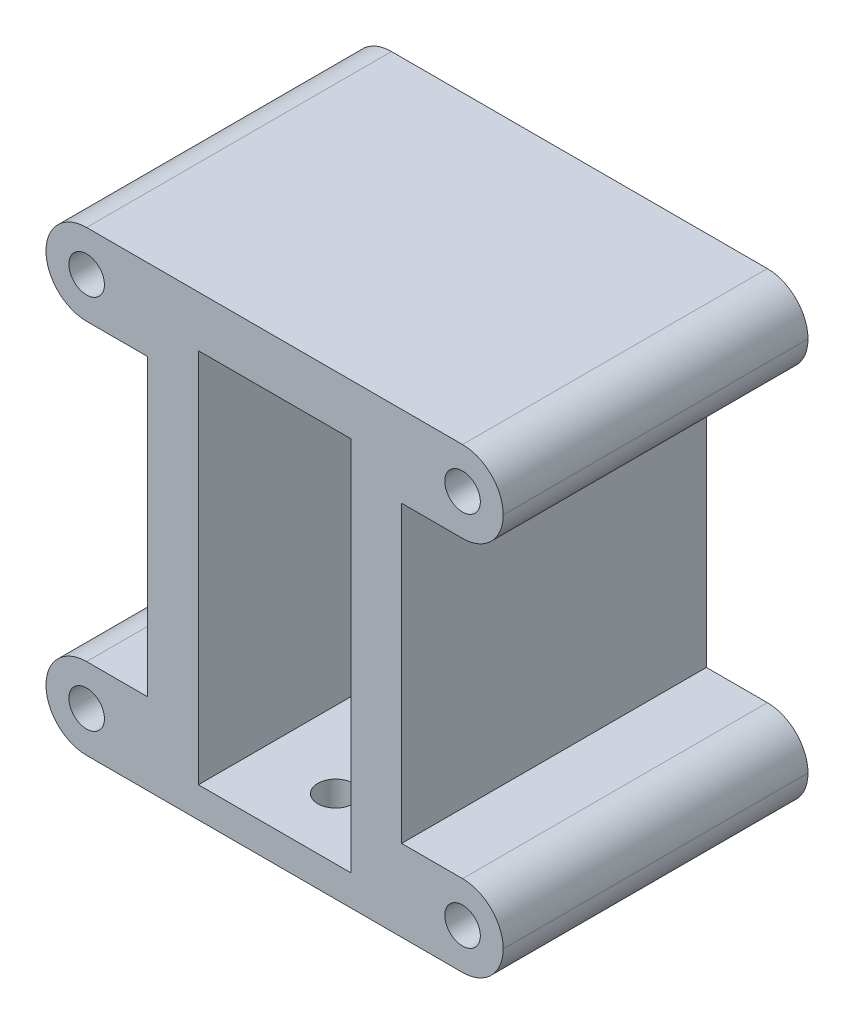
from build123d import *

# Parameters (mm, degrees)
CROQUIS3_W               = 25
CROQUIS3_H               = 45
CROQUIS3_W_2             = 15
CROQUIS3_H_2             = 37
SALIENTE_EXTRUIR1_DEPTH  = 30
CROQUIS4_W               = 30
CROQUIS4_H               = 8
SALIENTE_EXTRUIR2_DEPTH  = 10
CROQUIS5_R               = 1.75
CORTAR_EXTRUIR1_DEPTH    = 49.567948266
REDONDEO1_R              = 4
REDONDEO1_OF_SIMETR_A1_R = 4
CROQUIS7_R               = 1.75
CORTAR_EXTRUIR2_DEPTH    = 59.25672149


with BuildPart() as part:
    # Croquis3 → Saliente-Extruir1 (new body)
    with BuildSketch(Plane.XY):
        with Locations((-4.515654699, -4.5)):
            Rectangle(CROQUIS3_W, CROQUIS3_H)
        with Locations((-4.515654699, -5.5)):
            Rectangle(CROQUIS3_W_2, CROQUIS3_H_2, mode=Mode.SUBTRACT)
    extrude(amount=SALIENTE_EXTRUIR1_DEPTH)

    # Croquis4 → Saliente-Extruir2 (add)
    with BuildSketch(Plane.ZY.offset(17.015654699)):
        with Locations((15, 14)):
            Rectangle(CROQUIS4_W, CROQUIS4_H)
        with Locations((15, -23)):
            Rectangle(CROQUIS4_W, CROQUIS4_H)
    saliente_extruir2 = extrude(amount=SALIENTE_EXTRUIR2_DEPTH)

    # Croquis5 → Cortar-Extruir1 (cut, symmetric)
    with BuildSketch(Plane.XY.offset(30)):
        with Locations((-23.015654699, 14)):
            Circle(CROQUIS5_R)
        with Locations((-23.015654699, -23)):
            Circle(CROQUIS5_R)
    cortar_extruir1 = extrude(amount=CORTAR_EXTRUIR1_DEPTH, both=True, mode=Mode.SUBTRACT)

    # Redondeo1
    redondeo1_edges = [part.edges().sort_by_distance(p)[0] for p in [
        (-27.015654699, -27, 15),
        (-27.015654699, -19, 15),
        (-27.015654699, 10, 15),
        (-27.015654699, 18, 15),
    ]]
    fillet(redondeo1_edges, radius=REDONDEO1_R - 0.0001)  # a hair under: the kernel refuses the full size

    # Simetría1: Saliente-Extruir2, Cortar-Extruir1 across plane
    add(saliente_extruir2.mirror(Plane.ZY.offset(4.515654699)))
    add(cortar_extruir1.mirror(Plane.ZY.offset(4.515654699)), mode=Mode.SUBTRACT)

    # Redondeo1 of Simetría1
    redondeo1_of_simetr_a1_edges = [part.edges().sort_by_distance(p)[0] for p in [
        (17.984345301, -27, 15),
        (17.984345301, -19, 15),
        (17.984345301, 10, 15),
        (17.984345301, 18, 15),
    ]]
    fillet(redondeo1_of_simetr_a1_edges, radius=REDONDEO1_OF_SIMETR_A1_R - 0.0001)  # a hair under: the kernel refuses the full size

    # Croquis7 → Cortar-Extruir2 (cut, through all)
    with BuildSketch(Plane(origin=(0, -24, 0), x_dir=(1, 0, 0), z_dir=(0, 1, 0))):
        with Locations(Location((-4.515654699, -24, 0), (0, 0, 270))):
            Circle(CROQUIS7_R)
        with Locations(Location((-4.515654699, -15, 0), (0, 0, 270))):
            Circle(CROQUIS7_R)
        with Locations(Location((-4.515654699, -6, 0), (0, 0, 270))):
            Circle(CROQUIS7_R)
    extrude(amount=-CORTAR_EXTRUIR2_DEPTH, mode=Mode.SUBTRACT)


solid = part.part
